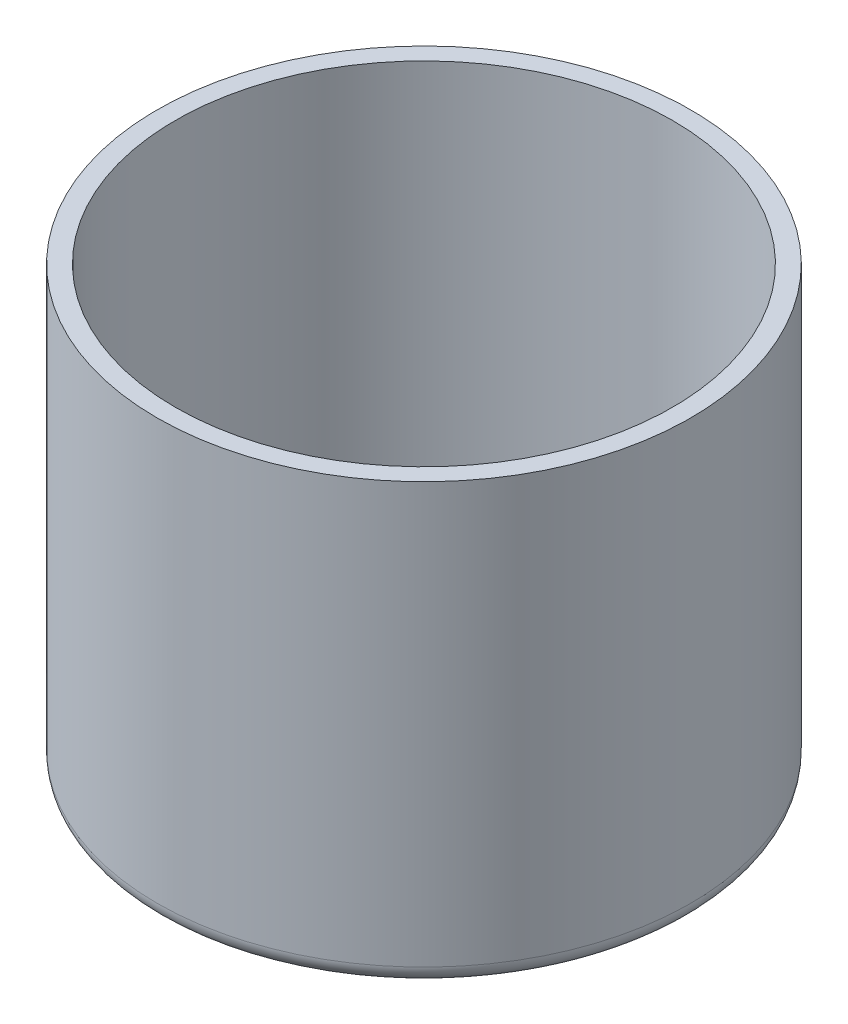
from build123d import *

# Parameters (mm, degrees)
SKETCH1_R               = 68
BOSS_EXTRUDE1_DEPTH     = 115
SHELL1_T                = 5
FILLET1_R               = 5
CUT_EXTRUDE1_DEPTH      = 159.297188857
CUT_EXTRUDE1_DEPTH_BACK = 159.297188857
SKETCH2_R               = 40
FILLET3_R               = 2.5


# Some blends are built 0.0001 mm under size
with BuildPart() as part:
    # Sketch1 → Boss-Extrude1 (new body)
    with BuildSketch(Plane(origin=(0, 0, 0), x_dir=(1, 0, 0), z_dir=(0, 1, 0))):
        with Locations(Location((0, 0, 0), (0, 0, 270))):
            Circle(SKETCH1_R)
    extrude(amount=BOSS_EXTRUDE1_DEPTH)

    # Shell1
    shell1_openings = [part.faces().sort_by_distance(p)[0] for p in [
        (0, 115, 0),
    ]]
    offset(amount=SHELL1_T, openings=shell1_openings, kind=Kind.INTERSECTION)

    # Fillet1
    # the kernel refuses this fillet: 5 mm, written as the material it takes off along each edge
    with BuildSketch(Plane(origin=(0, -5, 0), x_dir=(0, 0, 1), z_dir=(1, 0, 0))) as fillet1_piece_1:
        with BuildLine():
            CenterArc((73 - FILLET1_R, -FILLET1_R), FILLET1_R, 0, 90)
            Line((73 - FILLET1_R, 0), (73, 0))
            Line((73, 0), (73, -FILLET1_R))
        make_face()
    revolve(axis=Axis((0, -5, 0), (0, -1, 0)), mode=Mode.SUBTRACT)

    # Sketch2 → Cut-Extrude1 (cut, two sides: drawn at the far end of the back side and taken through both)
    with BuildSketch(Plane.XZ.offset(5).offset(-CUT_EXTRUDE1_DEPTH_BACK)):
        with Locations(Location((0, 0, 0), (0, 0, 270))):
            Circle(SKETCH2_R)
    extrude(amount=CUT_EXTRUDE1_DEPTH + CUT_EXTRUDE1_DEPTH_BACK, mode=Mode.SUBTRACT)

    # Fillet3
    fillet3_edges = [part.edges().sort_by_distance(p)[0] for p in [
        (0, -5, 40),
        (0, 0, 40),
    ]]
    fillet(fillet3_edges, radius=FILLET3_R - 0.0001)  # a hair under: the kernel refuses the full size


solid = part.part
